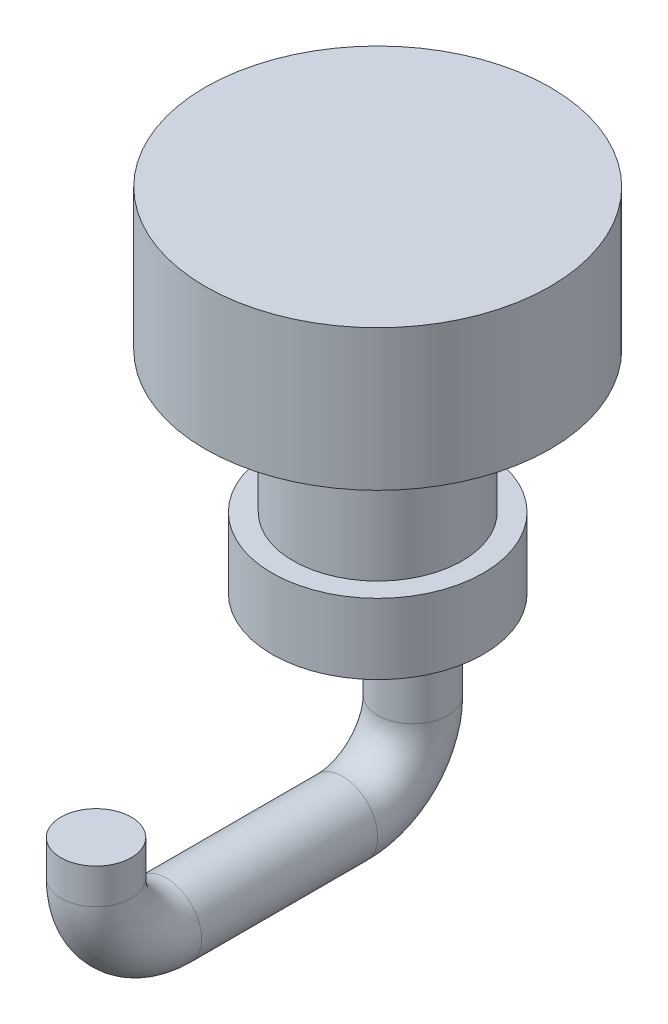
from build123d import *

# Parameters (mm, degrees)
MOAR_SPRINGS_COUNT = 4
SKETCH13_R         = 1.27


with BuildPart() as part:
    # Sketch1 → button body (revolve)
    with BuildSketch(Plane.XY):
        Polygon((0, 0), (6.223, 0), (6.223, -5.08), (3.048, -5.08), (3.048, -10.16), (3.81, -10.16), (3.81, -12.7), (0, -12.7), align=None)
    revolve(axis=Axis((0, -12.7, 0), (0, 1, 0)))


with BuildPart() as moar_springs_1:
    # moar springs: pattern copy
    add(part.part.rotate(Axis((0, 0, 0), (0, -1, 0)), 1 * 360 / MOAR_SPRINGS_COUNT))


with BuildPart() as moar_springs_2:
    # moar springs: pattern copy
    add(part.part.rotate(Axis((0, 0, 0), (0, -1, 0)), 2 * 360 / MOAR_SPRINGS_COUNT))


with BuildPart() as moar_springs_3:
    # moar springs: pattern copy
    add(part.part.rotate(Axis((0, 0, 0), (0, -1, 0)), 3 * 360 / MOAR_SPRINGS_COUNT))


with BuildPart() as part_1:
    add(part.part)

    add(moar_springs_1.part)  # hook for baton merges moar springs_1

    add(moar_springs_2.part)  # hook for baton merges moar springs_2

    add(moar_springs_3.part)  # hook for baton merges moar springs_3
    # hook for baton: sweep along a path in Sketch12
    with BuildLine(Plane(origin=(0, 0, 0), x_dir=(0, 0, -1), z_dir=(1, 0, 0))) as hook_for_baton_path:
        Line((0, -12.7), (0, -16.51))
        ThreePointArc((0, -16.51), (-0.371974388, -17.408025612), (-1.27, -17.78))
        Line((-1.27, -17.78), (-7.62, -17.78))
        ThreePointArc((-7.62, -17.78), (-8.518025612, -17.408025612), (-8.89, -16.51))
        Line((-8.89, -16.51), (-8.89, -15.24))
    # Sketch13 → hook for baton (sweep)
    with BuildSketch(Plane(origin=(0, -12.7, 0), x_dir=(-1, 0, 0), z_dir=(0, -1, 0))):
        with Locations((0, 1.27)):
            Circle(SKETCH13_R)
    sweep(path=hook_for_baton_path.line)


solid = part_1.part
